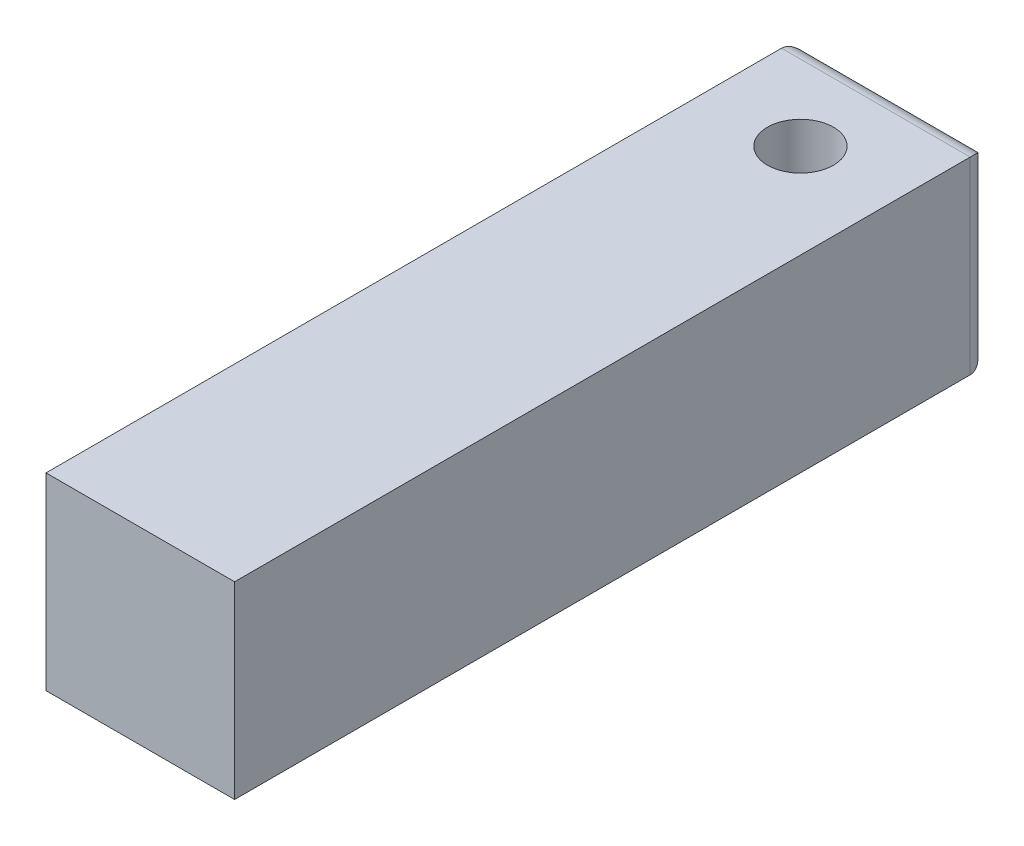
from build123d import *

# Parameters (mm, degrees)
SKIZZE1_W                       = 10
SKIZZE1_H                       = 40
SKIZZE1_R                       = 1.75
AUFSATZ_LINEAR_AUSTRAGEN1_DEPTH = 10
VERRUNDUNG1_R                   = 1


with BuildPart() as part:
    # Skizze1 → Aufsatz-Linear austragen1 (new body)
    with BuildSketch(Plane(origin=(0, 0, 0), x_dir=(1, 0, 0), z_dir=(0, 1, 0))):
        with Locations((-5, 20)):
            Rectangle(SKIZZE1_W, SKIZZE1_H)
        with Locations((-5, 35)):
            Circle(SKIZZE1_R, mode=Mode.SUBTRACT)
    extrude(amount=-AUFSATZ_LINEAR_AUSTRAGEN1_DEPTH)

    # Verrundung1
    verrundung1_edges = [part.edges().sort_by_distance(p)[0] for p in [
        (-5, 0, -40),
        (-5, -10, -40),
        (-10, -5, -40),
        (0, -5, -40),
    ]]
    fillet(verrundung1_edges, radius=VERRUNDUNG1_R)


solid = part.part
